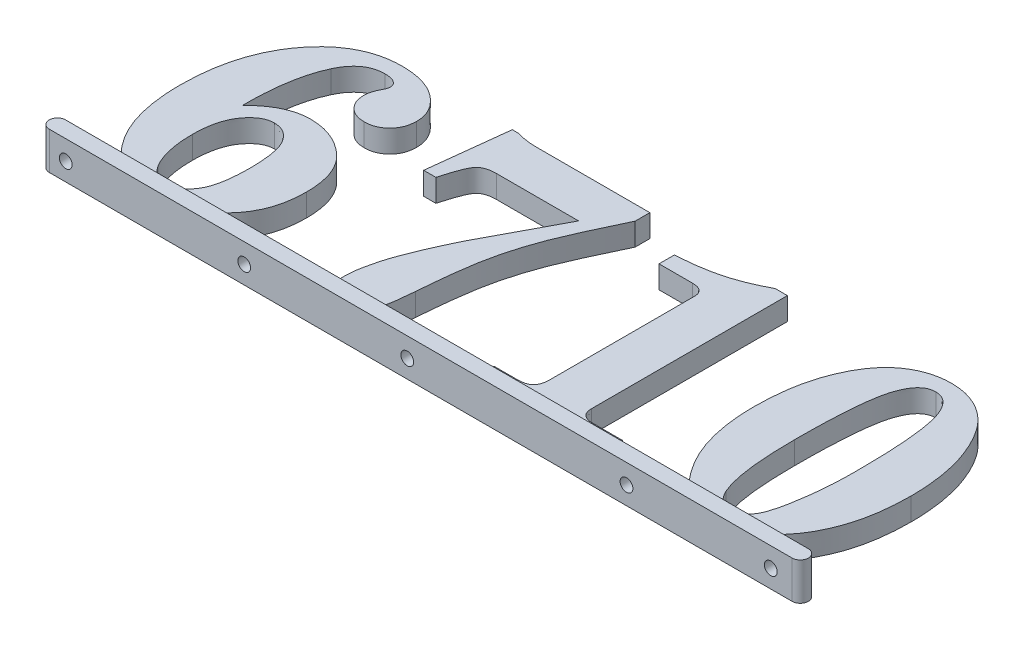
from build123d import *

# Parameters (mm, degrees)
BOSS_EXTRUDE2_DEPTH           = 6
BOSS_EXTRUDE2_2_DEPTH         = 6
BOSS_EXTRUDE2_3_DEPTH         = 6
BOSS_EXTRUDE2_4_DEPTH         = 6
BOSS_EXTRUDE3_DEPTH           = 10
SKETCH3_W                     = 1.7
SKETCH3_H                     = 4.309872114
M3_CLEARANCE_HOLE1_AT_2_COUNT = 2
M3_CLEARANCE_HOLE1_AT_2_PITCH = 47.533330584
M3_CLEARANCE_HOLE1_AT_3_COUNT = 2
M3_CLEARANCE_HOLE1_AT_3_PITCH = 90.948023095
M3_CLEARANCE_HOLE1_AT_4_COUNT = 2
M3_CLEARANCE_HOLE1_AT_4_PITCH = 149.340578323
M3_CLEARANCE_HOLE1_AT_5_COUNT = 2
M3_CLEARANCE_HOLE1_AT_5_PITCH = 187.760535065


with BuildPart() as part:
    # Sketch1 → Boss-Extrude2 (new body)
    with BuildSketch(Plane(origin=(0, 0, 0), x_dir=(1, 0, 0), z_dir=(0, 1, 0))):
        with BuildLine():
            add(Edge.make_bspline(
                [(-66.854337291, 12.891513647), (-66.383840504, 13.367301995), (-65.470204589, 14.291213346), (-63.990780098, 15.487603655), (-62.504530209, 16.516916436), (-60.977440285, 17.35041721), (-59.427116664, 18.004314546), (-57.843469372, 18.464044953), (-56.235400945, 18.758695727), (-55.148628705, 18.790538488), (-54.604637772, 18.806477589)],
                knots=[0, 0, 0, 0, 1.14685279, 2.227020303, 3.25778058, 4.243883266, 5.205520637, 6.137553452, 7.067740234, 8, 8, 8, 8], degree=3))
            add(Edge.make_bspline(
                [(-54.604637772, 18.806477589), (-54.0909529, 18.795091947), (-53.067962507, 18.77241773), (-51.55509009, 18.564662751), (-50.084004676, 18.216394996), (-48.650728925, 17.746943286), (-47.258778637, 17.131546194), (-45.910378127, 16.379833684), (-44.604122097, 15.489219335), (-43.33583199, 14.487800131), (-42.167111384, 13.335001881), (-41.135772804, 12.042680388), (-40.284899234, 10.59759133), (-39.565456525, 9.028286902), (-39.02111653, 7.314480702), (-38.650165608, 5.466904732), (-38.396253974, 3.489690558), (-38.372824111, 2.122469026), (-38.360747548, 1.417755634)],
                knots=[0, 0, 0, 0, 0.921430366, 1.835005203, 2.733790666, 3.63125474, 4.53744909, 5.460480171, 6.397454921, 7.371835466, 8.35641149, 9.336744903, 10.329751773, 11.358043918, 12.428808762, 13.547976459, 14.736142032, 16, 16, 16, 16], degree=3))
            add(Edge.make_bspline(
                [(-38.360747548, 1.417755634), (-38.378470646, 0.653874271), (-38.413230377, -0.844301195), (-38.666916624, -3.033229363), (-39.1008784, -5.111036454), (-39.706066597, -7.074183416), (-40.502632769, -8.916504006), (-41.461927679, -10.649066292), (-42.595060716, -12.265778197), (-43.891638579, -13.753633224), (-45.331524782, -15.088450961), (-46.882078172, -16.264589347), (-48.551649742, -17.253029982), (-50.330222152, -18.050316043), (-52.204993936, -18.696091415), (-54.189783309, -19.132952915), (-56.275918746, -19.408851761), (-57.703260146, -19.440269923), (-58.433463894, -19.456342924)],
                knots=[0, 0, 0, 0, 1.124503782, 2.205452389, 3.238774073, 4.245737988, 5.224441622, 6.188502486, 7.156597096, 8.125556767, 9.088485155, 10.042346181, 10.985545993, 11.938221513, 12.907502871, 13.899455546, 14.925396942, 16, 16, 16, 16], degree=3))
            add(Edge.make_bspline(
                [(-58.433463894, -19.456342924), (-59.202292014, -19.440070567), (-60.709298571, -19.408174558), (-62.903305004, -19.061959161), (-64.98371168, -18.534865173), (-66.936022051, -17.777390277), (-68.777970087, -16.824385174), (-70.471032351, -15.620869844), (-72.070730175, -14.237674108), (-72.998407543, -13.159591217), (-73.468920625, -12.612793244)],
                knots=[0, 0, 0, 0, 1.077432938, 2.111913519, 3.107156056, 4.082332679, 5.042599031, 6.007714502, 6.989523273, 8, 8, 8, 8], degree=3))
            add(Edge.make_bspline(
                [(-73.468920625, -12.612793244), (-73.984966138, -11.927965084), (-75.025010884, -10.547753628), (-76.314785577, -8.254542461), (-77.428795215, -5.792322739), (-78.326063488, -3.136195304), (-79.027275108, -0.298060288), (-79.511598426, 2.727378872), (-79.826295589, 5.935320389), (-79.861788336, 8.137565675), (-79.879978317, 9.266213166)],
                knots=[0, 0, 0, 0, 0.884761302, 1.783159275, 2.710236377, 3.672702966, 4.67426494, 5.72608122, 6.834619948, 8, 8, 8, 8], degree=3))
            add(Edge.make_bspline(
                [(-79.879978317, 9.266213166), (-79.855920536, 10.547684383), (-79.808896063, 13.052508384), (-79.431307688, 16.71261967), (-78.832366068, 20.186229076), (-77.963048866, 23.465796456), (-76.86183073, 26.562428764), (-75.490239404, 29.458159962), (-73.896460157, 32.180315116), (-72.625996109, 33.833047389), (-71.993359727, 34.656036884)],
                knots=[0, 0, 0, 0, 1.133819616, 2.216217228, 3.25261669, 4.250146373, 5.215103852, 6.156762494, 7.082147103, 8, 8, 8, 8], degree=3))
            add(Edge.make_bspline(
                [(-71.993359727, 34.656036884), (-71.404713548, 35.33862932), (-70.2531518, 36.673977047), (-68.32865208, 38.4276526), (-66.300270769, 39.907315988), (-64.175191183, 41.138290316), (-61.929102879, 42.062766734), (-59.590403186, 42.74716432), (-57.141032433, 43.144980644), (-55.475268104, 43.201086863), (-54.630078477, 43.229554512)],
                knots=[0, 0, 0, 0, 1.077933104, 2.108748126, 3.107440555, 4.077942819, 5.040091909, 6.006832857, 6.988689958, 8, 8, 8, 8], degree=3))
            add(Edge.make_bspline(
                [(-54.630078477, 43.229554512), (-54.091204631, 43.220351651), (-53.04087274, 43.202414135), (-51.506020021, 43.046358651), (-50.051564981, 42.79381377), (-48.675167633, 42.442187097), (-47.38539001, 41.976734624), (-46.166704349, 41.43835491), (-45.042117446, 40.767614619), (-44.00797934, 40.008001958), (-43.068082834, 39.189162793), (-42.254988065, 38.317341668), (-41.540755117, 37.432050382), (-40.98235566, 36.488760334), (-40.526722765, 35.52600639), (-40.226419563, 34.517071493), (-40.023345335, 33.481213798), (-40.000497912, 32.774414125), (-39.988952676, 32.417254833)],
                knots=[0, 0, 0, 0, 1.280040497, 2.494957523, 3.66094062, 4.784909987, 5.865092024, 6.915599989, 7.945325014, 8.968921257, 9.96115259, 10.901878114, 11.798696123, 12.657358619, 13.500275447, 14.322407915, 15.152280873, 16, 16, 16, 16], degree=3))
            add(Edge.make_bspline(
                [(-39.988952676, 32.417254833), (-40.0126279, 31.918783155), (-40.058459934, 30.953809342), (-40.435370678, 29.574386296), (-41.07166603, 28.342169573), (-41.937207447, 27.277156218), (-42.982791678, 26.406306252), (-44.175222258, 25.76837232), (-45.503909025, 25.38947068), (-46.431458277, 25.343141541), (-46.908824471, 25.319298102)],
                knots=[0, 0, 0, 0, 1.077878115, 2.086626381, 3.067810202, 4.059839936, 5.037668978, 5.994462296, 6.967843595, 8, 8, 8, 8], degree=3))
            add(Edge.make_bspline(
                [(-46.908824471, 25.319298102), (-47.327160462, 25.334795923), (-48.144067013, 25.365059328), (-49.303627438, 25.721159318), (-50.37677758, 26.237482012), (-51.293030553, 26.997635816), (-52.064574861, 27.895110039), (-52.622402779, 28.931052096), (-52.947213575, 30.078736538), (-52.991743528, 30.876022715), (-53.014593702, 31.285143454)],
                knots=[0, 0, 0, 0, 1.049887225, 2.050169649, 3.029080605, 4.031298804, 5.023857807, 5.993641735, 6.970454023, 8, 8, 8, 8], degree=3))
            add(Edge.make_bspline(
                [(-53.014593702, 31.285143454), (-53.002134949, 31.604043368), (-52.977161339, 32.243279246), (-52.779773147, 33.195015136), (-52.444901617, 34.128051719), (-52.139454481, 34.722742199), (-51.984245144, 35.024927108)],
                knots=[0, 0, 0, 0, 0.975492519, 1.955377813, 2.961049503, 4, 4, 4, 4], degree=3))
            add(Edge.make_bspline(
                [(-51.984245144, 35.024927108), (-51.813022942, 35.344095969), (-51.515948671, 35.897860934), (-51.424942347, 36.517733809), (-51.386388573, 36.780335762)],
                knots=[0, 0, 0, 0, 1.1527232, 2, 2, 2, 2], degree=3))
            add(Edge.make_bspline(
                [(-51.386388573, 36.780335762), (-51.39966379, 36.951198864), (-51.425234511, 37.280315344), (-51.597637046, 37.757752931), (-51.917046095, 38.160500376), (-52.331143304, 38.524826802), (-52.865457438, 38.823509613), (-53.529692997, 39.015665059), (-54.307040064, 39.144760711), (-54.866894472, 39.15408689), (-55.164333285, 39.159041692)],
                knots=[0, 0, 0, 0, 0.821614146, 1.582593042, 2.397862583, 3.264505992, 4.222664505, 5.312087018, 6.57196865, 8, 8, 8, 8], degree=3))
            add(Edge.make_bspline(
                [(-55.164333285, 39.159041692), (-55.615310914, 39.143811149), (-56.496821465, 39.114040527), (-57.773468034, 38.82532416), (-58.962618696, 38.34793597), (-60.062482935, 37.682056266), (-61.070197722, 36.822848512), (-61.986606015, 35.777815055), (-62.8365255, 34.554328912), (-63.287805946, 33.632576141), (-63.52160492, 33.155035281)],
                knots=[0, 0, 0, 0, 0.98865928, 1.932498486, 2.855364993, 3.790677092, 4.741601763, 5.750209687, 6.834430628, 8, 8, 8, 8], degree=3))
            add(Edge.make_bspline(
                [(-63.52160492, 33.155035281), (-63.804783761, 32.51509163), (-64.386057935, 31.201495191), (-65.052622991, 29.08569742), (-65.64810438, 26.812562375), (-66.103490826, 24.357948542), (-66.48088115, 21.73651396), (-66.707485626, 18.941323725), (-66.856158833, 15.975746909), (-66.85495595, 13.939026416), (-66.854337291, 12.891513647)],
                knots=[0, 0, 0, 0, 0.810926718, 1.664569134, 2.568542236, 3.534797887, 4.557680347, 5.638540753, 6.785469718, 8, 8, 8, 8], degree=3))
        make_face()
        with BuildLine():
            add(Edge.make_bspline(
                [(-58.573387772, 13.10775964), (-58.837163945, 13.099120529), (-59.361588467, 13.081944747), (-60.13743887, 12.907034762), (-60.887840329, 12.624099357), (-61.622624457, 12.240760611), (-62.322477493, 11.732955693), (-63.015123932, 11.131406535), (-63.688693527, 10.416078087), (-64.333074003, 9.591575718), (-64.933716115, 8.669991002), (-65.438768202, 7.635908864), (-65.888222709, 6.520897671), (-66.238895539, 5.300519798), (-66.521904308, 3.992193233), (-66.700696965, 2.583158816), (-66.838748445, 1.085492843), (-66.849047757, 0.052796651), (-66.854337291, -0.477576898)],
                knots=[0, 0, 0, 0, 0.72062304, 1.432701027, 2.163059525, 2.91017238, 3.692212812, 4.522563263, 5.416878069, 6.375169563, 7.382199909, 8.419631538, 9.518097245, 10.666850774, 11.888478829, 13.176158843, 14.549727723, 16, 16, 16, 16], degree=3))
            add(Edge.make_bspline(
                [(-66.854337291, -0.477576898), (-66.848301472, -1.084147719), (-66.836511062, -2.269027202), (-66.707387333, -3.997581407), (-66.495498582, -5.629471252), (-66.188977745, -7.158270212), (-65.808677668, -8.586592356), (-65.35393094, -9.922631112), (-64.797399667, -11.157024491), (-64.3507596, -11.92093844), (-64.132181843, -12.29478443)],
                knots=[0, 0, 0, 0, 1.185141396, 2.315063096, 3.384968684, 4.398965278, 5.359698553, 6.271597075, 7.154150146, 8, 8, 8, 8], degree=3))
            add(Edge.make_bspline(
                [(-64.132181843, -12.29478443), (-63.973351555, -12.541426917), (-63.664598152, -13.020880228), (-63.106247549, -13.638216076), (-62.537176018, -14.189479347), (-61.904098062, -14.619178995), (-61.238239485, -14.973545616), (-60.524111311, -15.210793271), (-59.770717571, -15.355887542), (-59.256722001, -15.375680716), (-58.993159407, -15.385830103)],
                knots=[0, 0, 0, 0, 1.11768922, 2.172698641, 3.168847348, 4.134017328, 5.08221476, 6.039209804, 6.994561467, 8, 8, 8, 8], degree=3))
            add(Edge.make_bspline(
                [(-58.993159407, -15.385830103), (-58.724885764, -15.378075007), (-58.19571042, -15.362777917), (-57.425778149, -15.179552641), (-56.68109721, -14.938628074), (-55.986799203, -14.552495767), (-55.317295371, -14.07917463), (-54.687739671, -13.494935464), (-54.095012596, -12.805471877), (-53.530659485, -12.015414428), (-53.021067882, -11.090749967), (-52.573310074, -10.026448987), (-52.214346815, -8.81266191), (-51.909974024, -7.45698269), (-51.669502947, -5.957628507), (-51.512195632, -4.313361062), (-51.408441303, -2.526874271), (-51.393934739, -1.28759949), (-51.386388573, -0.642941481)],
                knots=[0, 0, 0, 0, 0.698008895, 1.376837075, 2.055214835, 2.732961503, 3.438635313, 4.189877025, 4.965855924, 5.806497206, 6.717227354, 7.713238723, 8.811529533, 10.013263989, 11.334824084, 12.768432859, 14.318971975, 16, 16, 16, 16], degree=3))
            add(Edge.make_bspline(
                [(-51.386388573, -0.642941481), (-51.388335492, -0.023684041), (-51.392085633, 1.169125154), (-51.502157567, 2.882856471), (-51.646859204, 4.454307952), (-51.859664162, 5.877943888), (-52.135364252, 7.154316138), (-52.474348, 8.280156307), (-52.880676118, 9.258110663), (-53.351447925, 10.095712027), (-53.886567506, 10.797648789), (-54.432511331, 11.422762952), (-55.02954409, 11.941096434), (-55.664013008, 12.372260558), (-56.336179304, 12.702729104), (-57.05172072, 12.934512607), (-57.800348412, 13.076116587), (-58.314132686, 13.097147474), (-58.573387772, 13.10775964)],
                knots=[0, 0, 0, 0, 1.714838689, 3.303109859, 4.754525667, 6.084961, 7.287483411, 8.368539622, 9.337005066, 10.215402188, 11.021069297, 11.777920732, 12.51041541, 13.204228335, 13.897544082, 14.577197095, 15.282054923, 16, 16, 16, 16], degree=3))
        make_face(mode=Mode.SUBTRACT)
    extrude(amount=BOSS_EXTRUDE2_DEPTH)



with BuildPart() as body_2:
    # Sketch1 → Boss-Extrude2 2 (new body)
    with BuildSketch(Plane(origin=(0, 0, 0), x_dir=(1, 0, 0), z_dir=(0, 1, 0))):
        with BuildLine():
            Line((-25.335106522, 43.229554512), (-23.541536811, 43.229554512))
            add(Edge.make_bspline(
                [(-23.541536811, 43.229554512), (-23.132364731, 43.102477524), (-22.286016125, 42.839626178), (-20.928801769, 42.597829733), (-19.462041753, 42.441414316), (-18.445374457, 42.424306871), (-17.919140977, 42.415451948)],
                knots=[0, 0, 0, 0, 0.900387805, 1.862399715, 2.893564454, 4, 4, 4, 4], degree=3))
            Line((-17.919140977, 42.415451948), (12.113611427, 42.415451948))
            Line((12.113611427, 42.415451948), (12.113611427, 38.510303711))
            add(Edge.make_bspline(
                [(12.113611427, 38.510303711), (11.65383266, 37.552908978), (10.7662305, 35.704660002), (9.511829664, 33.016339457), (8.346194978, 30.530656107), (7.322434721, 28.227466806), (6.399153895, 26.127401107), (5.602478904, 24.215490508), (4.892753629, 22.50532861), (4.13889814, 20.474615069), (3.305115275, 18.065898857), (2.44252813, 15.192149618), (1.691927264, 12.30257409), (1.151387759, 9.859371857), (0.77679421, 7.819469862), (0.516835553, 6.142540101), (0.244560473, 4.320482454), (-0.006621472, 2.348108511), (-0.249024681, 0.223680438), (-0.471610401, -2.050192911), (-0.706726293, -4.470410387), (-0.842233616, -6.133689475), (-0.912029599, -6.990397411)],
                knots=[0, 0, 0, 0, 1.334662253, 2.576563308, 3.728009402, 4.784624763, 5.743875046, 6.61077282, 7.387518037, 8.070409699, 9.332527534, 10.590081752, 11.839822537, 13.083574023, 13.733642267, 14.445840073, 15.215977696, 16.048731082, 16.944319248, 17.902918148, 18.91985255, 20, 20, 20, 20], degree=3))
            add(Edge.make_bspline(
                [(-0.912029599, -6.990397411), (-0.953981096, -7.4865163), (-1.033970008, -8.4324661), (-1.155501073, -9.786270442), (-1.302784402, -11.006111538), (-1.427157143, -12.099673384), (-1.606581414, -13.05395582), (-1.748756729, -13.884557471), (-1.911544273, -14.586275731), (-2.143885834, -15.336950404), (-2.486033224, -16.142474716), (-2.994838279, -16.999047017), (-3.631763146, -17.728638673), (-4.351563408, -18.359819663), (-5.183017963, -18.845103326), (-6.093616286, -19.210087442), (-7.098498854, -19.408227701), (-7.792954737, -19.440007745), (-8.149910208, -19.456342924)],
                knots=[0, 0, 0, 0, 1.471595986, 2.805891812, 4.016840911, 5.103377821, 6.057296722, 6.885645491, 7.593900517, 8.184504658, 9.206385778, 10.17354851, 11.115538814, 12.057529119, 12.990304534, 13.946771938, 14.944625559, 16, 16, 16, 16], degree=3))
            add(Edge.make_bspline(
                [(-8.149910208, -19.456342924), (-8.593734425, -19.442443038), (-9.436165581, -19.416059401), (-10.614535528, -19.063563324), (-11.645257275, -18.535971954), (-12.491925161, -17.758519522), (-13.154883905, -16.773681135), (-13.615275382, -15.587987072), (-13.899578921, -14.207651127), (-13.924438514, -13.224918556), (-13.937670625, -12.701835712)],
                knots=[0, 0, 0, 0, 1.047578551, 1.988428698, 2.887000566, 3.76863116, 4.679522352, 5.675421061, 6.762687432, 8, 8, 8, 8], degree=3))
            add(Edge.make_bspline(
                [(-13.937670625, -12.701835712), (-13.910169478, -12.038690114), (-13.850940208, -10.610472204), (-13.584372638, -9.205733078), (-13.441576875, -8.453237956)],
                knots=[0, 0, 0, 0, 0.928633639, 2, 2, 2, 2], degree=3))
            add(Edge.make_bspline(
                [(-13.441576875, -8.453237956), (-13.316089687, -7.837049785), (-13.060255233, -6.580808676), (-12.558819268, -4.698535958), (-11.973940759, -2.774580366), (-11.513743265, -1.497547458), (-11.279116939, -0.846467122)],
                knots=[0, 0, 0, 0, 0.952959637, 1.942827092, 2.951174384, 4, 4, 4, 4], degree=3))
            add(Edge.make_bspline(
                [(-11.279116939, -0.846467122), (-10.917721665, 0.110589014), (-10.167034228, 2.098578535), (-8.851424506, 5.123013825), (-7.41389896, 8.34116399), (-6.33863229, 10.512204304), (-5.783924631, 11.632198743)],
                knots=[0, 0, 0, 0, 0.899786655, 1.869029802, 2.900676898, 4, 4, 4, 4], degree=3))
            Line((-5.783924631, 11.632198743), (4.532281298, 31.018016051))
            Line((4.532281298, 31.018016051), (-17.38488617, 31.018016051))
            add(Edge.make_bspline(
                [(-17.38488617, 31.018016051), (-17.865672605, 31.000696655), (-18.757175398, 30.968582001), (-19.987235325, 30.682526914), (-20.988942089, 30.187409143), (-21.642028879, 29.576482564), (-22.041840852, 28.95346751), (-22.358518478, 28.35959848), (-22.701163347, 27.640880277), (-23.041070046, 26.779935216), (-23.393959554, 25.790379138), (-23.763815139, 24.666652996), (-24.142607068, 23.410408346), (-24.391097555, 22.525501428), (-24.521003958, 22.062887845)],
                knots=[0, 0, 0, 0, 1.363182398, 2.527693849, 3.55562031, 4.500456268, 5.021102578, 5.651108149, 6.410074046, 7.279318463, 8.276570693, 9.39153258, 10.636339674, 12, 12, 12, 12], degree=3))
            Line((-24.521003958, 22.062887845), (-27.777414214, 22.062887845))
            Line((-27.777414214, 22.062887845), (-25.335106522, 43.229554512))
        make_face()
    extrude(amount=BOSS_EXTRUDE2_2_DEPTH)


with BuildPart() as body_3:
    # Sketch1 → Boss-Extrude2 3 (new body)
    with BuildSketch(Plane(origin=(0, 0, 0), x_dir=(1, 0, 0), z_dir=(0, 1, 0))):
        with BuildLine():
            add(Edge.make_bspline(
                [(25.139252452, 35.902631435), (26.242601464, 35.981552649), (28.36482375, 36.13335263), (31.404961887, 36.51355773), (34.169719741, 37.00453076), (36.711324636, 37.611677675), (39.1257195, 38.362809936), (41.504268325, 39.292840684), (43.917658808, 40.354153833), (45.500567133, 41.18077906), (46.305919119, 41.601349384)],
                knots=[0, 0, 0, 0, 1.199954441, 2.308036743, 3.322280222, 4.245013151, 5.141290695, 6.063094323, 7.014541267, 8, 8, 8, 8], degree=3))
            Line((46.305919119, 41.601349384), (49.562329375, 41.601349384))
            Line((49.562329375, 41.601349384), (49.562329375, -10.564816481))
            add(Edge.make_bspline(
                [(49.562329375, -10.564816481), (49.568892524, -10.807919128), (49.581278545, -11.26670415), (49.760583048, -11.910945936), (50.01740375, -12.480307952), (50.411578672, -12.951021608), (50.907753356, -13.304902701), (51.472624802, -13.580689423), (52.128450437, -13.731856172), (52.589033653, -13.748738842), (52.831459984, -13.757624975)],
                knots=[0, 0, 0, 0, 1.120484824, 2.114586824, 3.070633238, 3.989559268, 4.915156355, 5.871202769, 6.879515176, 8, 8, 8, 8], degree=3))
            Line((52.831459984, -13.757624975), (60.959765273, -13.757624975))
            Line((60.959765273, -13.757624975), (60.959765273, -17.828137796))
            Line((60.959765273, -17.828137796), (26.76745758, -17.828137796))
            Line((26.76745758, -17.828137796), (26.76745758, -13.757624975))
            Line((26.76745758, -13.757624975), (32.974989632, -13.757624975))
            add(Edge.make_bspline(
                [(32.974989632, -13.757624975), (33.344578849, -13.746935127), (34.030240728, -13.727103321), (34.979254504, -13.547554628), (35.750043915, -13.212230924), (36.379134481, -12.751049638), (36.83205857, -12.11187825), (37.132945974, -11.315690021), (37.321157221, -10.369997101), (37.340488862, -9.683867955), (37.350790914, -9.31822193)],
                knots=[0, 0, 0, 0, 1.223878128, 2.270538581, 3.176047828, 3.987833001, 4.822145417, 5.729721666, 6.790142857, 8, 8, 8, 8], degree=3))
            Line((37.350790914, -9.31822193), (37.350790914, 29.046361403))
            add(Edge.make_bspline(
                [(37.350790914, 29.046361403), (37.341600334, 29.259125329), (37.324053354, 29.665341753), (37.17599648, 30.240046253), (36.896769853, 30.720993919), (36.531968051, 31.128978691), (36.059197207, 31.454703808), (35.480606357, 31.679393596), (34.799000258, 31.801573903), (34.315369646, 31.821461817), (34.0562196, 31.832118615)],
                knots=[0, 0, 0, 0, 1.038333216, 1.982422562, 2.863107799, 3.727835048, 4.635122932, 5.638404739, 6.734555863, 8, 8, 8, 8], degree=3))
            Line((34.0562196, 31.832118615), (25.139252452, 31.832118615))
            Line((25.139252452, 31.832118615), (25.139252452, 35.902631435))
        make_face()
    extrude(amount=BOSS_EXTRUDE2_3_DEPTH)


with BuildPart() as body_4:
    # Sketch1 → Boss-Extrude2 4 (new body)
    with BuildSketch(Plane(origin=(0, 0, 0), x_dir=(1, 0, 0), z_dir=(0, 1, 0))):
        with BuildLine():
            add(Edge.make_bspline(
                [(91.743018478, 43.229554512), (92.19715755, 43.21994603), (93.099534945, 43.200853912), (94.434893378, 43.042809891), (95.743061382, 42.792541078), (97.0075038, 42.418816021), (98.248562567, 41.959472928), (99.447237389, 41.383385999), (100.628372532, 40.724273884), (101.76236302, 39.941918726), (102.862726791, 39.047627022), (103.918799371, 38.027289112), (104.929915283, 36.876414443), (105.878071982, 35.583207438), (106.797246781, 34.17221104), (107.657379254, 32.624529738), (108.489826032, 30.955974665), (109.255474792, 29.15689103), (109.967774786, 27.2635508), (110.583294442, 25.280874032), (111.081105362, 23.216946941), (111.521575625, 21.080972567), (111.848720499, 18.868203915), (112.074168939, 16.579920877), (112.217391302, 14.216249144), (112.237845296, 12.611872019), (112.248226811, 11.797563326)],
                knots=[0, 0, 0, 0, 0.783353286, 1.556528255, 2.316964709, 3.078702167, 3.828792064, 4.597837111, 5.370977466, 6.16035441, 6.971600408, 7.814967772, 8.691081243, 9.611438033, 10.579385299, 11.594827356, 12.664708224, 13.795371439, 14.966745955, 16.153847369, 17.37462469, 18.628621801, 19.915729827, 21.231889093, 22.595033088, 24, 24, 24, 24], degree=3))
            add(Edge.make_bspline(
                [(112.248226811, 11.797563326), (112.237890214, 10.979015914), (112.217576661, 9.370400684), (112.074236571, 6.998233636), (111.846704997, 4.706561244), (111.533404302, 2.493700596), (111.116958452, 0.365118913), (110.585216126, -1.672090762), (110.000556343, -3.636669346), (109.292336715, -5.497839179), (108.539450676, -7.264818364), (107.709964329, -8.905994064), (106.834548794, -10.424812731), (105.901653763, -11.817033555), (104.925206289, -13.092053978), (103.89293137, -14.246293862), (102.796762186, -15.265750731), (101.647849016, -16.158552321), (100.460071774, -16.931603913), (99.251081685, -17.618061244), (97.999269645, -18.165061503), (96.736751047, -18.653091909), (95.429216494, -18.999232774), (94.101471584, -19.272747394), (92.738852812, -19.427066751), (91.823943429, -19.446512208), (91.361407901, -19.456342924)],
                knots=[0, 0, 0, 0, 1.406284431, 2.763640223, 4.081459323, 5.362045686, 6.602145978, 7.805387329, 8.978344051, 10.12172269, 11.224630942, 12.276937332, 13.279025939, 14.234707136, 15.154133307, 16.036206051, 16.891862049, 17.722466553, 18.532694941, 19.325175083, 20.107749255, 20.877675621, 21.64822209, 22.428283106, 23.205413217, 24, 24, 24, 24], degree=3))
            add(Edge.make_bspline(
                [(91.361407901, -19.456342924), (90.677212251, -19.435236584), (89.329621969, -19.393665584), (87.356275692, -19.037415744), (85.467542969, -18.468744306), (83.682624268, -17.642984344), (81.980277588, -16.605697644), (80.394516476, -15.315965484), (78.870454486, -13.827065378), (77.987289398, -12.679667425), (77.534384664, -12.091258789)],
                knots=[0, 0, 0, 0, 1.006793221, 1.982977764, 2.94283252, 3.903945464, 4.870901585, 5.870369468, 6.907882838, 8, 8, 8, 8], degree=3))
            add(Edge.make_bspline(
                [(77.534384664, -12.091258789), (76.989121722, -11.312275959), (75.891792769, -9.744591182), (74.512371405, -7.195722682), (73.333402259, -4.486006048), (72.387404315, -1.59995372), (71.633277449, 1.447871643), (71.10645892, 4.663440352), (70.780831807, 8.046762748), (70.746545797, 10.359401233), (70.728996042, 11.543156275)],
                knots=[0, 0, 0, 0, 0.91136616, 1.83410314, 2.773941956, 3.74232144, 4.743458871, 5.782422568, 6.864903233, 8, 8, 8, 8], degree=3))
            add(Edge.make_bspline(
                [(70.728996042, 11.543156275), (70.739269103, 12.382900179), (70.759414644, 14.029643617), (70.903028155, 16.456903773), (71.13023726, 18.795140431), (71.441332616, 21.046710428), (71.864994903, 23.202133057), (72.374411218, 25.269473877), (72.966822182, 27.250177163), (73.654865035, 29.134402381), (74.416846297, 30.906394945), (75.225300316, 32.568633221), (76.107694245, 34.091288329), (77.02277574, 35.504887697), (77.997998789, 36.783589125), (79.023914904, 37.943412171), (80.103692595, 38.974502576), (81.241547508, 39.884076779), (82.428219336, 40.665934209), (83.639830563, 41.367482418), (84.902002085, 41.931305135), (86.196151034, 42.411267223), (87.529442792, 42.774475303), (88.901193395, 43.048683892), (90.310671187, 43.199419352), (91.263556605, 43.219467112), (91.743018478, 43.229554512)],
                knots=[0, 0, 0, 0, 1.424170151, 2.792807233, 4.122324903, 5.407820816, 6.646105306, 7.846085, 9.017739189, 10.15068457, 11.246032462, 12.288053211, 13.283497983, 14.228929799, 15.142254636, 16.008203179, 16.852562344, 17.671298733, 18.475086615, 19.260916306, 20.042952803, 20.816478533, 21.599836485, 22.383986241, 23.186872872, 24, 24, 24, 24], degree=3))
        make_face()
        with BuildLine():
            add(Edge.make_bspline(
                [(99.222585786, 10.105756435), (99.218937432, 10.873217104), (99.211781643, 12.378495117), (99.191294456, 14.58359703), (99.135546373, 16.686600621), (99.076291893, 18.688301056), (98.989397522, 20.588291929), (98.86959268, 22.389869819), (98.749585803, 24.091266684), (98.592582104, 25.689225973), (98.432559358, 27.187413945), (98.237354485, 28.581544577), (98.042847403, 29.877463108), (97.806416019, 31.067290368), (97.572386531, 32.160313935), (97.305892924, 33.154019175), (97.016031041, 34.045582165), (96.795729302, 34.597687522), (96.691235625, 34.859562525)],
                knots=[0, 0, 0, 0, 1.47361689, 2.890315027, 4.234041615, 5.512890319, 6.735430187, 7.885704477, 8.979686438, 10.010145264, 10.968551577, 11.87239427, 12.712972213, 13.484174345, 14.201219133, 14.85886129, 15.458734281, 16, 16, 16, 16], degree=3))
            add(Edge.make_bspline(
                [(96.691235625, 34.859562525), (96.536972594, 35.198013831), (96.240565023, 35.848328613), (95.705861357, 36.726687877), (95.129276567, 37.476449053), (94.511121863, 38.100994269), (93.818678224, 38.55869782), (93.1017959, 38.916004601), (92.327090658, 39.125629973), (91.795104016, 39.147839375), (91.526772484, 39.159041692)],
                knots=[0, 0, 0, 0, 1.247935487, 2.3978365, 3.44285575, 4.419305757, 5.331372834, 6.216376252, 7.100348664, 8, 8, 8, 8], degree=3))
            add(Edge.make_bspline(
                [(91.526772484, 39.159041692), (91.206950591, 39.137509933), (90.571950357, 39.094759039), (89.649913609, 38.81032921), (88.806833528, 38.307855828), (88.036386252, 37.61371082), (87.320941135, 36.741546416), (86.685638612, 35.665533646), (86.123695655, 34.402956431), (85.601306362, 32.930378437), (85.158046172, 31.180924897), (84.788946288, 29.096720024), (84.462471493, 26.660795513), (84.199992362, 23.864291948), (84.005988643, 20.71625576), (83.851835987, 17.209251009), (83.765185181, 13.345647657), (83.758254529, 10.648533714), (83.754637068, 9.240772461)],
                knots=[0, 0, 0, 0, 0.464597589, 0.9224496, 1.38622981, 1.879351518, 2.421964082, 3.018818831, 3.688669387, 4.427036351, 5.286087035, 6.306980466, 7.50043566, 8.855595861, 10.386375329, 12.081902534, 13.954945207, 16, 16, 16, 16], degree=3))
            add(Edge.make_bspline(
                [(83.754637068, 9.240772461), (83.760540603, 8.057667589), (83.771907105, 5.779750543), (83.897481517, 2.500331398), (84.11323392, -0.507309339), (84.399000967, -3.249584806), (84.770766637, -5.726956743), (85.242238952, -7.929938104), (85.770141994, -9.873565071), (86.241637992, -11.043318931), (86.464072164, -11.595165039)],
                knots=[0, 0, 0, 0, 1.343461849, 2.58666389, 3.725947556, 4.767078647, 5.717049631, 6.568882361, 7.32485224, 8, 8, 8, 8], degree=3))
            add(Edge.make_bspline(
                [(86.464072164, -11.595165039), (86.604833478, -11.896260566), (86.874303418, -12.472670315), (87.385513911, -13.238076146), (87.90466474, -13.912618516), (88.509536218, -14.439739344), (89.141171174, -14.86845861), (89.828688682, -15.161423927), (90.55430458, -15.349302372), (91.054936868, -15.373484377), (91.310526491, -15.385830103)],
                knots=[0, 0, 0, 0, 1.218324774, 2.332330485, 3.372889248, 4.332135979, 5.264738872, 6.164139518, 7.062731472, 8, 8, 8, 8], degree=3))
            add(Edge.make_bspline(
                [(91.310526491, -15.385830103), (91.648280031, -15.368192105), (92.32770176, -15.332711679), (93.306758528, -14.979154927), (94.227854394, -14.425173616), (94.954884663, -13.808899315), (95.484057131, -13.156794016), (95.881828957, -12.541215635), (96.240865244, -11.796966248), (96.601891178, -10.942202454), (96.926241758, -9.962412341), (97.22929641, -8.861425007), (97.520450131, -7.643410366), (97.69452854, -6.78743728), (97.785185946, -6.34165943)],
                knots=[0, 0, 0, 0, 0.998947679, 2.009473408, 3.04727483, 4.179875218, 4.814539547, 5.533395361, 6.349194413, 7.262737599, 8.285174717, 9.408443893, 10.650356736, 12, 12, 12, 12], degree=3))
            add(Edge.make_bspline(
                [(97.785185946, -6.34165943), (98.005383528, -5.054494976), (98.453726309, -2.4337083), (98.901902509, 1.599894967), (99.173722052, 5.798218338), (99.206082983, 8.650966895), (99.222585786, 10.105756435)],
                knots=[0, 0, 0, 0, 0.94767456, 1.929553642, 2.944153806, 4, 4, 4, 4], degree=3))
        make_face(mode=Mode.SUBTRACT)
    extrude(amount=BOSS_EXTRUDE2_4_DEPTH)


with BuildPart() as part_1:
    add(part.part)

    add(body_2.part)  # Boss-Extrude3 merges body 2

    add(body_4.part)  # Boss-Extrude3 merges body 4
    # Sketch2 → Boss-Extrude3 (add)
    with BuildSketch(Plane(origin=(0, 0, 0), x_dir=(1, 0, 0), z_dir=(0, 1, 0))):
        with BuildLine():
            Line((-83.098748592, -17.99364836), (114.724381456, -17.99364836))
            ThreePointArc((114.724381456, -17.99364836), (116.879317513, -20.148584418), (114.724381456, -22.303520475))
            Line((114.724381456, -22.303520475), (-83.098748592, -22.303520475))
            ThreePointArc((-83.098748592, -22.303520475), (-85.25368465, -20.148584418), (-83.098748592, -17.99364836))
        make_face()
    extrude(amount=BOSS_EXTRUDE3_DEPTH)

    # Sketch3 → M3 Clearance Hole1 (revolve, cut)
    with BuildSketch(Plane(origin=(-78.727174385, 4.790247554, 17.99364836), x_dir=(0, 1, 0), z_dir=(1, 0, 0))):
        with Locations((0.85, 2.154936057)):
            Rectangle(SKETCH3_W, SKETCH3_H)
    m3_clearance_hole1 = revolve(axis=Axis((-78.727174385, 4.790247554, 11.64364836), (0, 0, 1)), mode=Mode.SUBTRACT)

    # M3 Clearance Hole1 at 2: M3 Clearance Hole1 ×2
    with Locations(*[(i * M3_CLEARANCE_HOLE1_AT_2_PITCH, 0, 0) for i in range(1, M3_CLEARANCE_HOLE1_AT_2_COUNT)]):
        add(m3_clearance_hole1, mode=Mode.SUBTRACT)

    # M3 Clearance Hole1 at 3: M3 Clearance Hole1 ×2
    with Locations(*[(i * M3_CLEARANCE_HOLE1_AT_3_PITCH, 0, 0) for i in range(1, M3_CLEARANCE_HOLE1_AT_3_COUNT)]):
        add(m3_clearance_hole1, mode=Mode.SUBTRACT)

    # M3 Clearance Hole1 at 4: M3 Clearance Hole1 ×2
    with Locations(*[(i * M3_CLEARANCE_HOLE1_AT_4_PITCH, 0, 0) for i in range(1, M3_CLEARANCE_HOLE1_AT_4_COUNT)]):
        add(m3_clearance_hole1, mode=Mode.SUBTRACT)

    # M3 Clearance Hole1 at 5: M3 Clearance Hole1 ×2
    with Locations(*[(i * M3_CLEARANCE_HOLE1_AT_5_PITCH, 0, 0) for i in range(1, M3_CLEARANCE_HOLE1_AT_5_COUNT)]):
        add(m3_clearance_hole1, mode=Mode.SUBTRACT)


solid = Compound([body_3.part, part_1.part])
